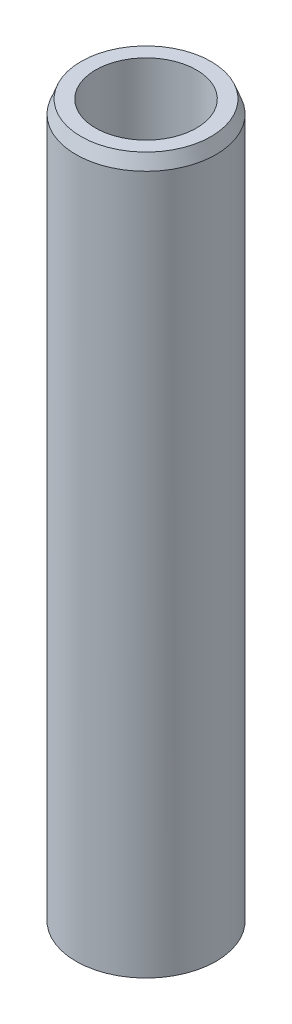
from build123d import *
from OCP.BRepFilletAPI import BRepFilletAPI_MakeChamfer

# Parameters (mm, degrees)
SKETCH1_R           = 20
BOSS_EXTRUDE1_DEPTH = 204.632580053
SKETCH2_R           = 14.395224629
CUT_EXTRUDE1_DEPTH  = 207.578055028
CHAMFER1_SIZE       = 3.741060553
CHAMFER1_SIZE2      = 1.434305701


with BuildPart() as part:
    # Sketch1 → Boss-Extrude1 (new body)
    with BuildSketch(Plane(origin=(0, 0, 0), x_dir=(1, 0, 0), z_dir=(0, 1, 0))):
        Circle(SKETCH1_R)
    extrude(amount=BOSS_EXTRUDE1_DEPTH)

    # Sketch2 → Cut-Extrude1 (cut, through all)
    with BuildSketch(Plane(origin=(0, 0, 0), x_dir=(1, 0, 0), z_dir=(0, 1, 0))):
        Circle(SKETCH2_R)
    extrude(amount=CUT_EXTRUDE1_DEPTH, mode=Mode.SUBTRACT)

    # Chamfer1: one chamfer whose edges measure the first distance from different faces: ONE call of the kernel's chamfer builder (chamfer() names one face for all edges)
    chamfer1_edges_1 = [part.edges().sort_by_distance(p)[0] for p in [
        (-20, 204.632580053, 0),
    ]]
    chamfer1_side_1 = [part.faces().sort_by_distance(p)[0] for p in [
        (-20, 102.316290027, 0),
    ]]
    chamfer1_edges_2 = [part.edges().sort_by_distance(p)[0] for p in [
        (-20, 0, 0),
    ]]
    chamfer1_side_2 = [part.faces().sort_by_distance(p)[0] for p in [
        (-19.434314575, 0, 0),
    ]]
    chamfer1 = BRepFilletAPI_MakeChamfer(part.part.solid().wrapped)
    for e in chamfer1_edges_1:
        chamfer1.Add(CHAMFER1_SIZE, CHAMFER1_SIZE2, e.wrapped, chamfer1_side_1[0].wrapped)  # the first distance lies on this face
    for e in chamfer1_edges_2:
        chamfer1.Add(CHAMFER1_SIZE, CHAMFER1_SIZE2, e.wrapped, chamfer1_side_2[0].wrapped)  # the first distance lies on this face
    add(Compound.cast(chamfer1.Shape()), mode=Mode.REPLACE)


solid = part.part
